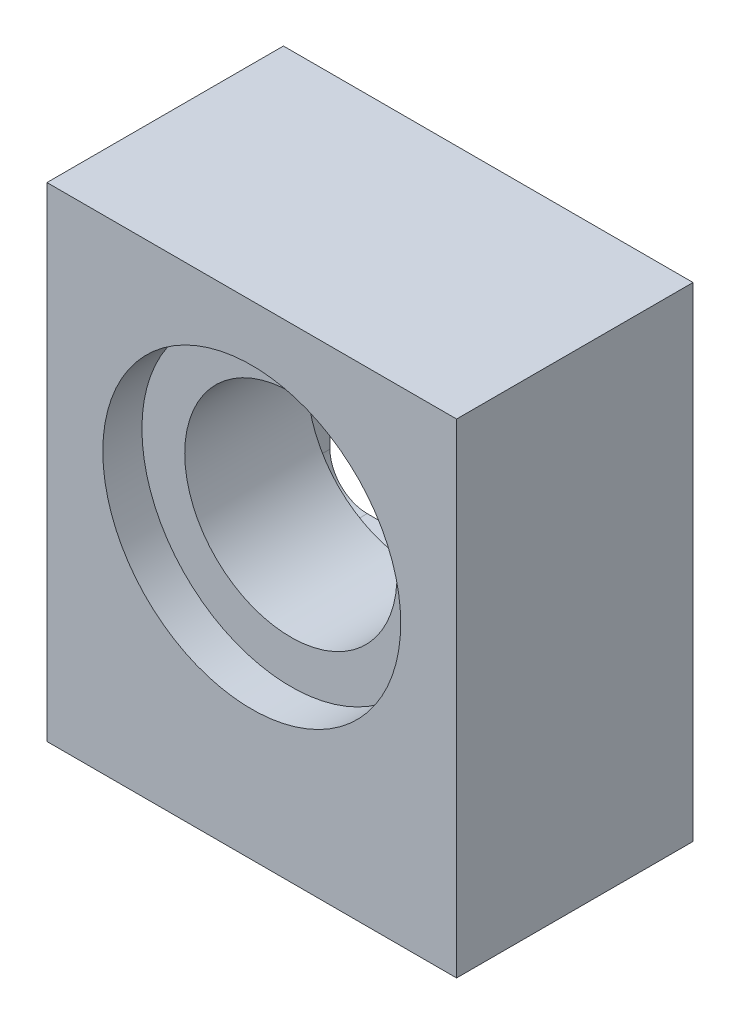
from build123d import *

# Parameters (mm, degrees)
SKETCH1_W                       = 22
SKETCH1_H                       = 26
SKETCH1_R                       = 5.7
BOSS_EXTRUDE1_DEPTH             = 12.7
CUT_EXTRUDE1_DEPTH              = 4
SKETCH3_R                       = 8
CUT_EXTRUDE2_DEPTH              = 2.1
TAP_DRILL_FOR_M3X0_5_TAP1_D     = 2.5
TAP_DRILL_FOR_M3X0_5_TAP1_DEPTH = 5
TAP_DRILL_FOR_M3X0_5_TAP1_TIP   = 0.751075774


with BuildPart() as part:
    # Sketch1 → Boss-Extrude1 (new body)
    with BuildSketch(Plane.XY):
        with Locations((11, 13)):
            Rectangle(SKETCH1_W, SKETCH1_H)
        with Locations((11, 15)):
            Circle(SKETCH1_R, mode=Mode.SUBTRACT)
    extrude(amount=BOSS_EXTRUDE1_DEPTH)

    # Sketch2 → Cut-Extrude1 (cut)
    with BuildSketch(Plane.XY):
        with BuildLine():
            Line((4.5, 23.5), (17.5, 23.5))
            ThreePointArc((17.5, 23.5), (18.914213562, 22.914213562), (19.5, 21.5))
            Line((19.5, 21.5), (19.5, 8.5))
            ThreePointArc((19.5, 8.5), (18.914213562, 7.085786438), (17.5, 6.5))
            Line((17.5, 6.5), (4.5, 6.5))
            ThreePointArc((4.5, 6.5), (3.085786438, 7.085786438), (2.5, 8.5))
            Line((2.5, 8.5), (2.5, 21.5))
            ThreePointArc((2.5, 21.5), (3.085786438, 22.914213562), (4.5, 23.5))
        make_face()
    extrude(amount=CUT_EXTRUDE1_DEPTH, mode=Mode.SUBTRACT)

    # Sketch3 → Cut-Extrude2 (cut)
    with BuildSketch(Plane(origin=(0, 0, 12.7), x_dir=(-1, 0, 0), z_dir=(0, 0, -1))):
        with Locations((-11, 15)):
            Circle(SKETCH3_R)
    extrude(amount=CUT_EXTRUDE2_DEPTH, mode=Mode.SUBTRACT)

    # Tap Drill for M3x0.5 Tap1
    with Locations(Plane(origin=(0, 0, 0), x_dir=(-1, 0, 0), z_dir=(0, -1, 0))):
        with Locations((-18, -3), (-4, -3), (-4, -9.7), (-18, -9.7), (-11, -6.35)):
            Hole(TAP_DRILL_FOR_M3X0_5_TAP1_D / 2, depth=TAP_DRILL_FOR_M3X0_5_TAP1_DEPTH)
            with Locations((0, 0, -(TAP_DRILL_FOR_M3X0_5_TAP1_DEPTH + TAP_DRILL_FOR_M3X0_5_TAP1_TIP / 2))):  # 118° drill point
                Cone(0, TAP_DRILL_FOR_M3X0_5_TAP1_D / 2, TAP_DRILL_FOR_M3X0_5_TAP1_TIP, mode=Mode.SUBTRACT)


solid = part.part
